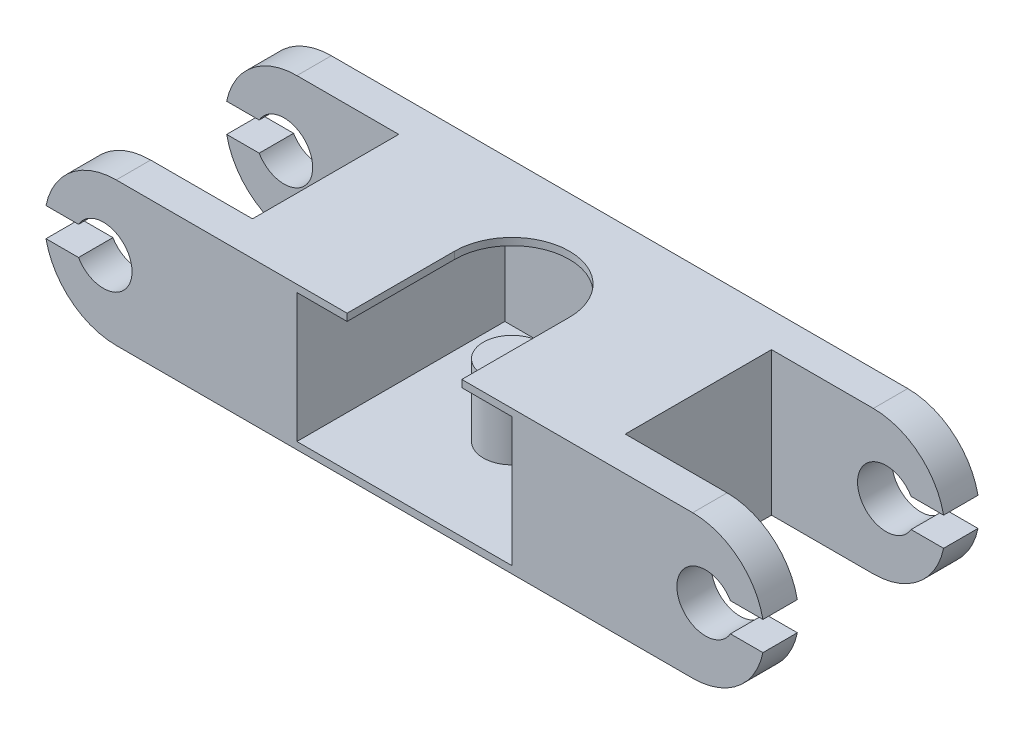
from build123d import *

# Parameters (mm, degrees)
SKETCH_1_W               = 50
SKETCH_1_H               = 10
EXTRUDE_1_DEPTH          = 7.5
CUT_EXTRUDE_1_DEPTH      = 6
SKETCH_4_W               = 15
SKETCH_4_H               = 9
CUT_EXTRUDE_2_DEPTH      = 14.5
SKETCH_5_R               = 2
EXTRUDE_2_DEPTH          = 5
SKETCH_6_W               = 12
SKETCH_6_H               = 10.2
CUT_EXTRUDE_3_DEPTH      = 28.950849719
CUT_EXTRUDE_4_DEPTH      = 30.580398915
CUT_EXTRUDE_4_DEPTH_BACK = 30.580398915
FILLET_1_R               = 5
CUT_EXTRUDE_START        = -5
SKETCH_8_R               = 0.75
CUT_EXTRUDE_5_DEPTH      = 10
EXTRUDE_START            = -0.5
SKETCH_5_2_R             = 2
EXTRUDE_1_2_DEPTH        = 0.5
CUT_EXTRUDE_START_2      = -10
SKETCH_5_3_R             = 2
CUT_EXTRUDE_1_2_DEPTH    = 10


with BuildPart() as part:
    # 草图1 → Extrude 1 (new, symmetric)
    with BuildSketch(Plane.XY):
        Rectangle(SKETCH_1_W, SKETCH_1_H)
    extrude(amount=EXTRUDE_1_DEPTH, both=True)

    # 草图3 → Cut-Extrude 1 (cut)
    with BuildSketch(Plane(origin=(0, 5, 0), x_dir=(1, 0, 0), z_dir=(0, 1, 0))):
        with BuildLine():
            Line((-4, 0), (-4, -11.498876283))
            Line((-4, -11.498876283), (4, -11.498876283))
            Line((4, -11.498876283), (4, 0))
            ThreePointArc((4, 0), (0, 4), (-4, 0))
        make_face()
    extrude(amount=-CUT_EXTRUDE_1_DEPTH, mode=Mode.SUBTRACT)

    # 草图4 → 切除-拉伸2 (cut)
    with BuildSketch(Plane.XY.offset(7.5)):
        Rectangle(SKETCH_4_W, SKETCH_4_H)
    extrude(amount=-CUT_EXTRUDE_2_DEPTH, mode=Mode.SUBTRACT)

    # 草图5 → 凸台-拉伸2 (add)
    with BuildSketch(Plane(origin=(0, -4.5, 0), x_dir=(1, 0, 0), z_dir=(0, 1, 0))):
        with Locations(Location((0, 0, 0), (0, 0, 90))):
            Circle(SKETCH_5_R)
    extrude(amount=EXTRUDE_2_DEPTH)

    # 草图6 → 切除-拉伸3 (cut, through all)
    with BuildSketch(Plane(origin=(0, 5, 0), x_dir=(1, 0, 0), z_dir=(0, 1, 0))):
        with Locations((-19, 0)):
            Rectangle(SKETCH_6_W, SKETCH_6_H)
        with Locations((19, 0)):
            Rectangle(SKETCH_6_W, SKETCH_6_H)
    extrude(amount=-CUT_EXTRUDE_3_DEPTH, mode=Mode.SUBTRACT)

    # 草图7 → 切除-拉伸4 (cut, two sides: drawn at the far end of the back side and taken through both)
    with BuildSketch(Plane.XY.offset(7.5).offset(-CUT_EXTRUDE_4_DEPTH_BACK)):
        with BuildLine():
            Line((-25, 1), (-22.732050808, 1))
            ThreePointArc((-22.732050808, 1), (-19, 0), (-22.732050808, -1))
            Line((-22.732050808, -1), (-25, -1))
            Line((-25, -1), (-25, 1))
        make_face()
        with BuildLine():
            Line((25, -1), (22.732050808, -1))
            ThreePointArc((22.732050808, -1), (19, 0), (22.732050808, 1))
            Line((22.732050808, 1), (25, 1))
            Line((25, 1), (25, -1))
        make_face()
    extrude(amount=CUT_EXTRUDE_4_DEPTH + CUT_EXTRUDE_4_DEPTH_BACK, mode=Mode.SUBTRACT)

    # 圆角1
    # the kernel refuses this fillet: 5 mm, written as the material it takes off along each edge
    with BuildSketch(Plane(origin=(25, 5, -19.747448714), x_dir=(-1, 0, 0), z_dir=(0, 0, 1)), Plane(origin=(25, 5, -7.147448714), x_dir=(-1, 0, 0), z_dir=(0, 0, 1)), Plane(origin=(-25, 5, 7.147448714), x_dir=(1, 0, 0), z_dir=(0, 0, -1)), Plane(origin=(-25, 5, 19.747448714), x_dir=(1, 0, 0), z_dir=(0, 0, -1))) as fillet_1_piece_1:
        with BuildLine():
            CenterArc((4.898979486, 5), FILLET_1_R, 191.536959033, 78.463040967)
            Line((0, 4), (-0.09797959, 3.98))
            ThreePointArc((-0.09797959, 3.98), (-0.1, 2), (-0.1, 0))
            Line((-0.1, 0), (0, -0.1))
            Line((0, -0.1), (4.898979486, -0.1))
            Line((4.898979486, -0.1), (4.898979486, 0))
        make_face()
    extrude(amount=26.894897428, mode=Mode.SUBTRACT)
    with BuildSketch(Plane(origin=(25, -5, -19.747448714), x_dir=(-1, 0, 0), z_dir=(0, 0, 1)), Plane(origin=(25, -5, -7.147448714), x_dir=(-1, 0, 0), z_dir=(0, 0, 1)), Plane(origin=(-25, -5, 7.147448714), x_dir=(1, 0, 0), z_dir=(0, 0, -1)), Plane(origin=(-25, -5, 19.747448714), x_dir=(1, 0, 0), z_dir=(0, 0, -1))) as fillet_1_piece_2:
        with BuildLine():
            CenterArc((4.898979486, -5), FILLET_1_R, 90, 78.463040967)
            Line((0, -4), (-0.09797959, -3.98))
            ThreePointArc((-0.09797959, -3.98), (-0.1, -2), (-0.1, 0))
            Line((-0.1, 0), (0, 0.1))
            Line((0, 0.1), (4.898979486, 0.1))
            Line((4.898979486, 0.1), (4.898979486, 0))
        make_face()
    extrude(amount=26.894897428, mode=Mode.SUBTRACT)

    # 草图8 → 切除-拉伸5 (cut)
    with BuildSketch(Plane.XY.offset(7.5).offset(CUT_EXTRUDE_START)):
        with Locations((10, -3)):
            Circle(SKETCH_8_R)
        with Locations(Location((-10, -3, 0), (0, 0, 180))):
            Circle(SKETCH_8_R)
    extrude(amount=-CUT_EXTRUDE_5_DEPTH, mode=Mode.SUBTRACT)

    # 草图5<2> → Extrude 1 2 (add)
    with BuildSketch(Plane(origin=(0, -4.5, 0), x_dir=(1, 0, 0), z_dir=(0, 1, 0)).offset(EXTRUDE_START)):
        with Locations(Location((0, 0, 0), (0, 0, 90))):
            Circle(SKETCH_5_2_R)
    extrude(amount=EXTRUDE_1_2_DEPTH)

    # 草图5<3> → Cut-Extrude 1 2 (cut)
    with BuildSketch(Plane(origin=(0, -4.5, 0), x_dir=(1, 0, 0), z_dir=(0, 1, 0)).offset(CUT_EXTRUDE_START_2)):
        with Locations(Location((0, 0, 0), (0, 0, 270))):
            Circle(SKETCH_5_3_R)
    extrude(amount=CUT_EXTRUDE_1_2_DEPTH, mode=Mode.SUBTRACT)


with BuildPart() as cut_extrude_1_2_piece_1:
    # of the separate pieces the step leaves, piece 1, a body of its own (cut_extrude_1_2_pieces)
    add(part.part.solids().sort_by_distance((-13, -5, -5.1))[0])


with BuildPart() as cut_extrude_1_2_piece_2:
    # of the separate pieces the step leaves, piece 2, a body of its own (cut_extrude_1_2_pieces)
    add(part.part.solids().sort_by_distance((0, 0.5, -2))[0])


solid = Compound([cut_extrude_1_2_piece_1.part, cut_extrude_1_2_piece_2.part])
